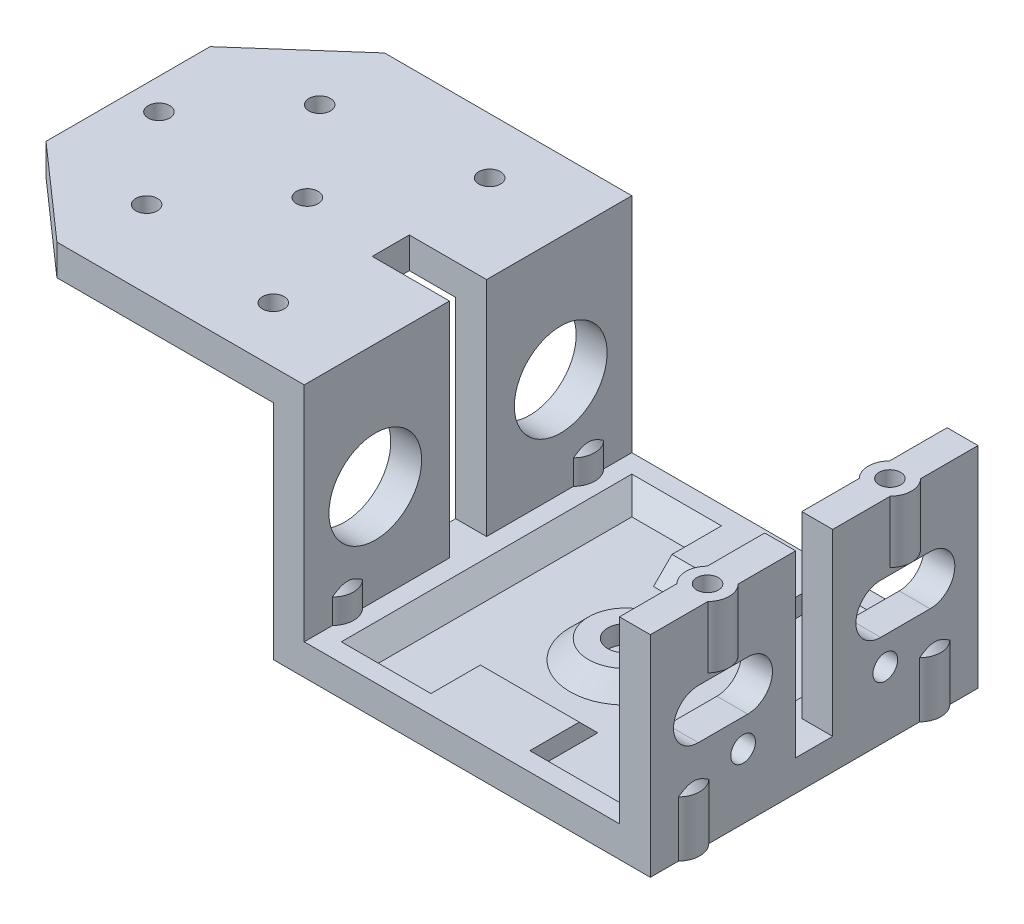
from build123d import *

# Parameters (mm, degrees)
IZIM1_W                     = 61
IZIM1_H                     = 53
Y_KSEKLIK_EKSTR_ZYON1_DEPTH = 5
IZIM2_W                     = 5
IZIM2_H                     = 53
Y_KSEKLIK_EKSTR_ZYON2_DEPTH = 36
IZIM3_W                     = 53
IZIM3_H                     = 5
Y_KSEKLIK_EKSTR_ZYON3_DEPTH = 50
IZIM4_W                     = 5
IZIM4_H                     = 53
Y_KSEKLIK_EKSTR_ZYON4_DEPTH = 29
KES_EKSTR_ZYON1_DEPTH       = 29
IZIM6_W                     = 47
IZIM6_H                     = 49
KES_EKSTR_ZYON2_DEPTH       = 3
IZIM7_R                     = 5
IZIM7_R_2                   = 2.9
Y_KSEKLIK_EKSTR_ZYON5_DEPTH = 4
PAH2_SIZE                   = 4
KES_EKSTR_ZYON4_START       = -61
IZIM8_W                     = 6
IZIM8_H                     = 36
KES_EKSTR_ZYON4_DEPTH       = 61
IZIM9_W                     = 12.5
IZIM9_H                     = 6
KES_EKSTR_ZYON5_DEPTH       = 5
KES_EKSTR_ZYON7_START       = -31.5
IZIM11_W                    = 51
IZIM11_H                    = 29
KES_EKSTR_ZYON7_DEPTH       = 10
PAH3_SIZE                   = 4
IZIM12_R                    = 1.75
KES_EKSTR_ZYON8_DEPTH       = 12
IZIM13_R                    = 3.5
IZIM13_R_2                  = 2
Y_KSEKLIK_EKSTR_ZYON6_DEPTH = 10
PAH4_SIZE                   = 1
PAH5_SIZE                   = 1
IZIM14_R                    = 1.75
KES_EKSTR_ZYON9_DEPTH       = 10
IZIM15_R                    = 3.5
IZIM15_R_2                  = 2
Y_KSEKLIK_EKSTR_ZYON7_DEPTH = 10
IZIM16_R                    = 1.75
KES_EKSTR_ZYON10_DEPTH      = 10
IZIM17_R                    = 1.75
KES_EKSTR_ZYON11_DEPTH      = 10
IZIM18_R                    = 2
KES_EKSTR_ZYON12_DEPTH      = 10
IZIM23_R                    = 7.5
KES_EKSTR_ZYON17_DEPTH      = 11
KES_EKSTR_ZYON18_DEPTH      = 10
IZIM25_W                    = 16
IZIM25_H                    = 12
Y_KSEKLIK_EKSTR_ZYON8_DEPTH = 5
PAH6_SIZE                   = 4


# Some blends are built 0.0001 mm under size
with BuildPart() as part:
    # Çizim1 → Yükseklik-Ekstrüzyon1 (new body)
    with BuildSketch(Plane(origin=(0, 0, 0), x_dir=(1, 0, 0), z_dir=(0, 1, 0))):
        with Locations((30.5, 26.5)):
            Rectangle(IZIM1_W, IZIM1_H)
    extrude(amount=Y_KSEKLIK_EKSTR_ZYON1_DEPTH)

    # Çizim2 → Yükseklik-Ekstrüzyon2 (add)
    with BuildSketch(Plane(origin=(0, 5, 0), x_dir=(1, 0, 0), z_dir=(0, 1, 0))):
        with Locations((2.5, 26.5)):
            Rectangle(IZIM2_W, IZIM2_H)
    extrude(amount=Y_KSEKLIK_EKSTR_ZYON2_DEPTH)

    # Çizim3 → Yükseklik-Ekstrüzyon3 (add)
    with BuildSketch(Plane.ZY):
        with Locations((-26.5, 38.5)):
            Rectangle(IZIM3_W, IZIM3_H)
    extrude(amount=Y_KSEKLIK_EKSTR_ZYON3_DEPTH)

    # Çizim4 → Yükseklik-Ekstrüzyon4 (add)
    with BuildSketch(Plane(origin=(0, 5, 0), x_dir=(1, 0, 0), z_dir=(0, 1, 0))):
        with Locations((58.5, 26.5)):
            Rectangle(IZIM4_W, IZIM4_H)
    extrude(amount=Y_KSEKLIK_EKSTR_ZYON4_DEPTH)

    # Çizim5 → Kes-Ekstrüzyon1 (cut)
    with BuildSketch(Plane(origin=(0, 41, 0), x_dir=(1, 0, 0), z_dir=(0, 1, 0))):
        Polygon((-50, 39.771243445), (-35, 53), (-50, 53), align=None)
        Polygon((-35, 0), (-50, 13.228756555), (-50, 0), align=None)
    extrude(amount=-KES_EKSTR_ZYON1_DEPTH, mode=Mode.SUBTRACT)

    # Çizim6 → Kes-Ekstrüzyon2 (cut)
    with BuildSketch(Plane(origin=(0, 5, 0), x_dir=(1, 0, 0), z_dir=(0, 1, 0))):
        with Locations((30.5, 26.5)):
            Rectangle(IZIM6_W, IZIM6_H)
    extrude(amount=-KES_EKSTR_ZYON2_DEPTH, mode=Mode.SUBTRACT)

    # Çizim7 → Yükseklik-Ekstrüzyon5 (add)
    with BuildSketch(Plane(origin=(0, 2, 0), x_dir=(1, 0, 0), z_dir=(0, 1, 0))):
        with Locations(Location((30.5, 26.5, 0), (0, 0, 270))):
            Circle(IZIM7_R)
        with Locations(Location((30.5, 26.5, 0), (0, 0, 270))):
            Circle(IZIM7_R_2, mode=Mode.SUBTRACT)
    extrude(amount=Y_KSEKLIK_EKSTR_ZYON5_DEPTH)

    # Pah2
    # the kernel refuses this chamfer: 4 mm, written as the material it adds along each edge
    with BuildSketch(Plane(origin=(54, 2, -2), x_dir=(0, 0.9996219169112968, 0.027495876610586382), z_dir=(-1, 0, 0))) as pah2_piece_1_section:
        Polygon((PAH2_SIZE * 0.999621916911, PAH2_SIZE * 0.0274958766106), (-PAH2_SIZE * 0.0274958766106, PAH2_SIZE * 0.999621916911), (0, 0), align=None)
    pah2_piece_1 = extrude(amount=47, mode=Mode.PRIVATE)
    pah2_piece_1 = split(pah2_piece_1, bisect_by=Plane(origin=(30.5, 5, -3.4), z_dir=(0, -1, 0)), keep=Keep.TOP, mode=Mode.PRIVATE)
    add(pah2_piece_1)
    with BuildSketch(Plane(origin=(54, 2, -51), x_dir=(0.02749587661058563, 0.9996219169112968, 0), z_dir=(0, 0, 1))) as pah2_piece_2_section:
        Polygon((PAH2_SIZE * 0.999621916911, PAH2_SIZE * 0.0274958766106), (-PAH2_SIZE * 0.0274958766106, PAH2_SIZE * 0.999621916911), (0, 0), align=None)
    pah2_piece_2 = extrude(amount=49, mode=Mode.PRIVATE)
    pah2_piece_2 = split(pah2_piece_2, bisect_by=Plane(origin=(52.6, 5, -26.5), z_dir=(0, -1, 0)), keep=Keep.TOP, mode=Mode.PRIVATE)
    add(pah2_piece_2)
    with BuildSketch(Plane(origin=(7, 2, -2), x_dir=(-0.027495876610586275, 0.9996219169112968, 0), z_dir=(0, 0, -1))) as pah2_piece_3_section:
        Polygon((PAH2_SIZE * 0.999621916911, PAH2_SIZE * 0.0274958766106), (-PAH2_SIZE * 0.0274958766106, PAH2_SIZE * 0.999621916911), (0, 0), align=None)
    pah2_piece_3 = extrude(amount=49, mode=Mode.PRIVATE)
    pah2_piece_3 = split(pah2_piece_3, bisect_by=Plane(origin=(8.4, 5, -26.5), z_dir=(0, -1, 0)), keep=Keep.TOP, mode=Mode.PRIVATE)
    add(pah2_piece_3)
    with BuildSketch(Plane(origin=(7, 2, -51), x_dir=(0, 0.9996219169112968, -0.02749587661058563), z_dir=(1, 0, 0))) as pah2_piece_4_section:
        Polygon((PAH2_SIZE * 0.999621916911, PAH2_SIZE * 0.0274958766106), (-PAH2_SIZE * 0.0274958766106, PAH2_SIZE * 0.999621916911), (0, 0), align=None)
    pah2_piece_4 = extrude(amount=47, mode=Mode.PRIVATE)
    pah2_piece_4 = split(pah2_piece_4, bisect_by=Plane(origin=(30.5, 5, -49.6), z_dir=(0, -1, 0)), keep=Keep.TOP, mode=Mode.PRIVATE)
    add(pah2_piece_4)

    # Çizim8 → Kes-Ekstrüzyon4 (cut)
    with BuildSketch(Plane(origin=(61, 0, 0), x_dir=(0, 0, -1), z_dir=(1, 0, 0)).offset(KES_EKSTR_ZYON4_START)):
        with Locations((26.5, 23)):
            Rectangle(IZIM8_W, IZIM8_H)
    extrude(amount=KES_EKSTR_ZYON4_DEPTH, mode=Mode.SUBTRACT)

    # Çizim9 → Kes-Ekstrüzyon5 (cut)
    with BuildSketch(Plane(origin=(0, 41, 0), x_dir=(1, 0, 0), z_dir=(0, 1, 0))):
        with Locations((-1.25, 26.5)):
            Rectangle(IZIM9_W, IZIM9_H)
    extrude(amount=-KES_EKSTR_ZYON5_DEPTH, mode=Mode.SUBTRACT)

    # Çizim11 → Kes-Ekstrüzyon7 (cut)
    with BuildSketch(Plane.XY.offset(KES_EKSTR_ZYON7_START)):
        with Locations((30.5, 19.5)):
            Rectangle(IZIM11_W, IZIM11_H)
    extrude(amount=KES_EKSTR_ZYON7_DEPTH, mode=Mode.SUBTRACT)

    # Pah3
    # the kernel refuses this chamfer: 4 mm, written as the material it adds along each edge
    with BuildSketch(Plane(origin=(30.5, 2, -26.5), x_dir=(0, 0, 1), z_dir=(-1, 0, 0))) as pah3_piece_1_section:
        Polygon((5 + PAH3_SIZE, 0), (5, PAH3_SIZE), (5, 0), align=None)
    pah3_piece_1 = revolve(axis=Axis((30.5, 2, -26.5), (0, 1, 0)), mode=Mode.PRIVATE)
    pah3_piece_1 = split(pah3_piece_1, bisect_by=Plane(origin=(30.5, 5, -34.0078168), z_dir=(0, -1, 0)), keep=Keep.TOP, mode=Mode.PRIVATE)
    add(pah3_piece_1)

    # Çizim12 → Kes-Ekstrüzyon8 (cut)
    with BuildSketch(Plane.XZ):
        with Locations(Location((2.5, -7, 0), (0, 0, 270))):
            Circle(IZIM12_R)
        with Locations(Location((2.5, -46, 0), (0, 0, 90))):
            Circle(IZIM12_R)
        with Locations(Location((58.5, -7, 0), (0, 0, 90))):
            Circle(IZIM12_R)
        with Locations(Location((58.5, -46, 0), (0, 0, 270))):
            Circle(IZIM12_R)
    extrude(amount=-KES_EKSTR_ZYON8_DEPTH, mode=Mode.SUBTRACT)

    # Çizim13 → Yükseklik-Ekstrüzyon6 (add)
    # profile 1 of 4: a face of its own
    with BuildSketch(Plane.XZ):
        with Locations((2.5, -7)):
            Circle(IZIM13_R)
        with Locations((2.5, -7)):
            Circle(IZIM13_R_2, mode=Mode.SUBTRACT)
    # profile 2 of 4: a face of its own
    with BuildSketch(Plane.XZ):
        with Locations((58.5, -7)):
            Circle(IZIM13_R)
        with Locations((58.5, -7)):
            Circle(IZIM13_R_2, mode=Mode.SUBTRACT)
    # profile 3 of 4: a face of its own
    with BuildSketch(Plane.XZ):
        with Locations((58.5, -46)):
            Circle(IZIM13_R)
        with Locations((58.5, -46)):
            Circle(IZIM13_R_2, mode=Mode.SUBTRACT)
    # profile 4 of 4: a face of its own
    with BuildSketch(Plane.XZ):
        with Locations((2.5, -46)):
            Circle(IZIM13_R)
        with Locations((2.5, -46)):
            Circle(IZIM13_R_2, mode=Mode.SUBTRACT)
    extrude(amount=-Y_KSEKLIK_EKSTR_ZYON6_DEPTH)

    # Pah4
    pah4_edges = [part.edges().sort_by_distance(p)[0] for p in [
        (62, 10, -7),
    ]]
    chamfer(pah4_edges, length=PAH4_SIZE - 0.0001)  # a hair under: the kernel refuses the full size

    # Pah5
    pah5_edges = [part.edges().sort_by_distance(p)[0] for p in [
        (6, 10, -46),
        (6, 10, -7),
        (55, 10, -7),
        (55, 10, -46),
        (-1, 10, -46),
        (-1, 10, -7),
        (62, 10, -46),
    ]]
    chamfer(pah5_edges, length=PAH5_SIZE - 0.0001)  # a hair under: the kernel refuses the full size

    # Çizim14 → Kes-Ekstrüzyon9 (cut)
    with BuildSketch(Plane(origin=(0, 34, 0), x_dir=(1, 0, 0), z_dir=(0, 1, 0))):
        with Locations(Location((58.5, 41.25, 0), (0, 0, 270))):
            Circle(IZIM14_R)
        with Locations(Location((58.5, 11.75, 0), (0, 0, 270))):
            Circle(IZIM14_R)
    extrude(amount=-KES_EKSTR_ZYON9_DEPTH, mode=Mode.SUBTRACT)

    # Çizim15 → Yükseklik-Ekstrüzyon7 (add)
    # profile 1 of 2: a face of its own
    with BuildSketch(Plane(origin=(0, 34, 0), x_dir=(1, 0, 0), z_dir=(0, 1, 0))):
        with Locations((58.5, 41.25)):
            Circle(IZIM15_R)
        with Locations((58.5, 41.25)):
            Circle(IZIM15_R_2, mode=Mode.SUBTRACT)
    # profile 2 of 2: a face of its own
    with BuildSketch(Plane(origin=(0, 34, 0), x_dir=(1, 0, 0), z_dir=(0, 1, 0))):
        with Locations((58.5, 11.75)):
            Circle(IZIM15_R)
        with Locations((58.5, 11.75)):
            Circle(IZIM15_R_2, mode=Mode.SUBTRACT)
    extrude(amount=-Y_KSEKLIK_EKSTR_ZYON7_DEPTH)

    # Çizim16 → Kes-Ekstrüzyon10 (cut)
    with BuildSketch(Plane.XZ.offset(-36)):
        with Locations(Location((-33, -12.5, 0), (0, 0, 270))):
            Circle(IZIM16_R)
        with Locations(Location((-33, -40.5, 0), (0, 0, 270))):
            Circle(IZIM16_R)
        with Locations(Location((-21, -26.5, 0), (0, 0, 270))):
            Circle(IZIM16_R)
        with Locations(Location((-45, -26.5, 0), (0, 0, 270))):
            Circle(IZIM16_R)
    extrude(amount=-KES_EKSTR_ZYON10_DEPTH, mode=Mode.SUBTRACT)

    # Çizim17 → Kes-Ekstrüzyon11 (cut)
    with BuildSketch(Plane(origin=(0, 41, 0), x_dir=(1, 0, 0), z_dir=(0, 1, 0))):
        with Locations(Location((-9, 44, 0), (0, 0, 270))):
            Circle(IZIM17_R)
        with Locations(Location((-9, 9, 0), (0, 0, 270))):
            Circle(IZIM17_R)
    extrude(amount=-KES_EKSTR_ZYON11_DEPTH, mode=Mode.SUBTRACT)

    # Çizim18 → Kes-Ekstrüzyon12 (cut)
    with BuildSketch(Plane(origin=(61, 0, 0), x_dir=(0, 0, -1), z_dir=(1, 0, 0))):
        with Locations((15, 10.5)):
            Circle(IZIM18_R)
        with Locations((38, 10.5)):
            Circle(IZIM18_R)
    extrude(amount=-KES_EKSTR_ZYON12_DEPTH, mode=Mode.SUBTRACT)

    # Çizim23 → Kes-Ekstrüzyon17 (cut)
    with BuildSketch(Plane.ZY):
        with Locations((-41.5, 21)):
            Circle(IZIM23_R)
        with Locations((-11.5, 21)):
            Circle(IZIM23_R)
    extrude(amount=-KES_EKSTR_ZYON17_DEPTH, mode=Mode.SUBTRACT)

    # Çizim24 → Kes-Ekstrüzyon18 (cut)
    with BuildSketch(Plane(origin=(61, 0, 0), x_dir=(0, 0, -1), z_dir=(1, 0, 0))):
        with BuildLine():
            Line((15.75, 15), (7.75, 15))
            ThreePointArc((7.75, 15), (3.75, 19), (7.75, 23))
            Line((7.75, 23), (15.75, 23))
            ThreePointArc((15.75, 23), (19.75, 19), (15.75, 15))
        make_face()
        with BuildLine():
            Line((37.25, 15), (45.25, 15))
            ThreePointArc((45.25, 15), (49.25, 19), (45.25, 23))
            Line((45.25, 23), (37.25, 23))
            ThreePointArc((37.25, 23), (33.25, 19), (37.25, 15))
        make_face()
    extrude(amount=-KES_EKSTR_ZYON18_DEPTH, mode=Mode.SUBTRACT)

    # Çizim25 → Yükseklik-Ekstrüzyon8 (add)
    with BuildSketch(Plane(origin=(0, 5, 0), x_dir=(1, 0, 0), z_dir=(0, 1, 0))):
        with Locations((30.5, 44)):
            Rectangle(IZIM25_W, IZIM25_H)
        with Locations((30.5, 9)):
            Rectangle(IZIM25_W, IZIM25_H)
    extrude(amount=-Y_KSEKLIK_EKSTR_ZYON8_DEPTH)

    # Pah6
    # the kernel refuses this chamfer: 4 mm, written as the material it adds along each edge
    # the kernel refuses this chamfer: 4 mm, written as the material it takes off along each edge
    with BuildSketch(Plane(origin=(48.786731952, 5, -38), x_dir=(0, 0.027495876610586296, -0.9996219169112968), z_dir=(-1, 0, 0))) as pah6_2_piece_1_section:
        Polygon((PAH6_SIZE * 0.999621916911, PAH6_SIZE * 0.0274958766106), (-PAH6_SIZE * 0.0274958766106, PAH6_SIZE * 0.999621916911), (0, 0), align=None)
    pah6_2_piece_1 = extrude(amount=36.573463904, mode=Mode.PRIVATE)
    pah6_2_piece_1 = split(pah6_2_piece_1, bisect_by=Plane(origin=(30.5, 2, -39.4), z_dir=(0, 1, 0)), keep=Keep.TOP, mode=Mode.PRIVATE)
    add(pah6_2_piece_1, mode=Mode.SUBTRACT)
    with BuildSketch(Plane(origin=(48.786731952, 5, -15), x_dir=(0, 0.02749587661058627, 0.9996219169112968), z_dir=(-1, 0, 0))) as pah6_2_piece_2_section:
        Polygon((PAH6_SIZE * 0.999621916911, -PAH6_SIZE * 0.0274958766106), (-PAH6_SIZE * 0.0274958766106, -PAH6_SIZE * 0.999621916911), (0, 0), align=None)
    pah6_2_piece_2 = extrude(amount=36.573463904, mode=Mode.PRIVATE)
    pah6_2_piece_2 = split(pah6_2_piece_2, bisect_by=Plane(origin=(30.5, 2, -13.6), z_dir=(0, 1, 0)), keep=Keep.TOP, mode=Mode.PRIVATE)
    add(pah6_2_piece_2, mode=Mode.SUBTRACT)


solid = part.part
